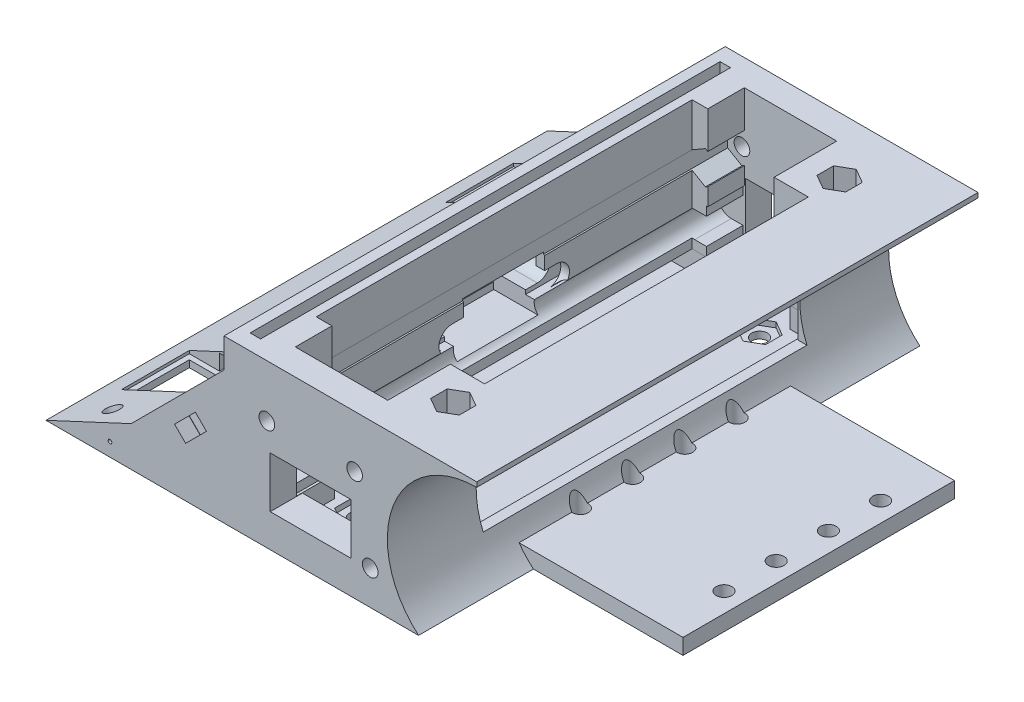
from build123d import *

# Parameters (mm, degrees)
EXTRUDE_1_DEPTH           = 48
EXTRUDE_1_DEPTH_BACK      = 48
SKETCH_2_W                = 35
SKETCH_2_H                = 22
CUT_EXTRUDE_1_DEPTH       = 50
SKETCH_3_W                = 15.5
SKETCH_3_H                = 8.4
CUT_EXTRUDE_2_DEPTH       = 50
SKETCH_4_W                = 15.5
SKETCH_4_H                = 11
CUT_EXTRUDE_3_DEPTH       = 20
SKETCH_7_W                = 15.5
SKETCH_7_H                = 8.4
CUT_EXTRUDE_6_DEPTH       = 116
CUT_EXTRUDE_7_DEPTH       = 43
CUT_EXTRUDE_7_DEPTH_BACK  = 43
SKETCH_10_R               = 1.5
CUT_EXTRUDE_9_DEPTH       = 10
CUT_EXTRUDE_10_DEPTH      = 13
CUT_EXTRUDE_11_REACH      = 74.435
SKETCH_12_W               = 25.251430991
SKETCH_12_H               = 72
EXTRUDE_2_DEPTH           = 10
EXTRUDE_START             = -96
EXTRUDE_3_DEPTH           = 96
CUT_EXTRUDE_12_DEPTH      = 120.230868609
EXTRUDE_4_DEPTH           = 96
CUT_EXTRUDE_13_DEPTH      = 5
CUT_EXTRUDE_14_REACH      = 77.945
SKETCH_19_W               = 8.551430991
SKETCH_19_H               = 62
CUT_EXTRUDE_16_DEPTH      = 4
CUT_EXTRUDE_17_DEPTH      = 2
CUT_EXTRUDE_17_DEPTH_BACK = 1
SKETCH_21_W               = 18.437607381
SKETCH_21_H               = 70.88414514
FILLET_1_R                = 10
FILLET_2_R                = 5
CUT_EXTRUDE_19_DEPTH      = 20
SKETCH_26_W               = 19
SKETCH_26_H               = 13
SKETCH_26_W_2             = 17
SKETCH_26_H_2             = 11
EXTRUDE_7_DEPTH           = 1.321078777
SKETCH_28_R               = 1.5
CUT_EXTRUDE_20_DEPTH      = 20
SKETCH_29_W               = 2
SKETCH_29_H               = 11
SKETCH_29_W_2             = 0.2
EXTRUDE_8_DEPTH           = 5
SKETCH_30_W               = 15.5
SKETCH_30_H               = 4.976277967
EXTRUDE_9_DEPTH           = 5
EXTRUDE_10_DEPTH          = 5
SKETCH_32_R               = 1.5
SKETCH_32_R_2             = 1.499999998
CUT_EXTRUDE_21_DEPTH      = 20
CUT_EXTRUDE_START         = -1.5
CUT_EXTRUDE_22_DEPTH      = 20
SKETCH_34_R               = 1.5
CUT_EXTRUDE_23_DEPTH      = 20
CUT_EXTRUDE_24_DEPTH      = 1
SKETCH_36_R               = 1.5
CUT_EXTRUDE_25_DEPTH      = 15
CUT_EXTRUDE_START_2       = -3
CUT_EXTRUDE_26_DEPTH      = 3
SKETCH_38_W               = 3.029039313
SKETCH_38_H               = 5.639389484
SKETCH_38_W_2             = 2.769556695
CUT_EXTRUDE_28_DEPTH      = 3
CUT_EXTRUDE_29_DEPTH      = 116.243221181
CUT_EXTRUDE_29_DEPTH_BACK = 116.243221181
SKETCH_39_R               = 1.5
CUT_EXTRUDE_START_3       = -7
CUT_EXTRUDE_30_DEPTH      = 79
SKETCH_44_R               = 1.5
CUT_EXTRUDE_33_DEPTH      = 120.230868609
SKETCH_45_R               = 0.35
CUT_EXTRUDE_34_DEPTH      = 120.230868609
EXTRUDE_11_DEPTH          = 96
SKETCH_48_W               = 2
SKETCH_48_H               = 90
CUT_EXTRUDE_35_DEPTH      = 20


with BuildPart() as part:
    # Эскиз1 → Бобышка-Вытянуть1 (new, two sides: drawn at the far end of the back side and taken through both)
    with BuildSketch(Plane.XY.offset(-EXTRUDE_1_DEPTH_BACK)):
        Polygon((-50, -50), (-33.686459833, -42.392871289), (-20.251430991, -28.957842446), (-7.251430991, -28.957842446), (-7.251430991, -39.957842446), (10.448569009, -39.957842446), (10.448569009, -28.957842446), (15, -28.957842446), (15, -47), (50, -47), (50, -50), align=None)
    extrude(amount=EXTRUDE_1_DEPTH + EXTRUDE_1_DEPTH_BACK)

    # Эскиз2 → Вырез-Вытянуть1 (cut)
    with BuildSketch(Plane(origin=(0, -47, 0), x_dir=(1, 0, 0), z_dir=(0, 1, 0))):
        with Locations((32.5, 37)):
            Rectangle(SKETCH_2_W, SKETCH_2_H)
        with Locations((32.5, -37)):
            Rectangle(SKETCH_2_W, SKETCH_2_H)
    extrude(amount=-CUT_EXTRUDE_1_DEPTH, mode=Mode.SUBTRACT)

    # Эскиз3 → Вырез-Вытянуть2 (cut)
    with BuildSketch(Plane(origin=(0, 0, 0), x_dir=(0, 0, -1), z_dir=(1, 0, 0))):
        with Locations((0, -35.675356867)):
            Rectangle(SKETCH_3_W, SKETCH_3_H)
    extrude(amount=-CUT_EXTRUDE_2_DEPTH, mode=Mode.SUBTRACT)

    # Эскиз4 → Вырез-Вытянуть3 (cut)
    with BuildSketch(Plane(origin=(0, 0, 0), x_dir=(0, 0, -1), z_dir=(1, 0, 0))):
        with Locations((0, -35.675356867)):
            Rectangle(SKETCH_4_W, SKETCH_4_H)
    extrude(amount=-CUT_EXTRUDE_3_DEPTH, mode=Mode.SUBTRACT)

    # Эскиз7 → Вырез-Вытянуть6 (cut)
    with BuildSketch(Plane.XY.offset(48)):
        with Locations((0.698569009, -39.478921223)):
            Rectangle(SKETCH_7_W, SKETCH_7_H)
    extrude(amount=-CUT_EXTRUDE_6_DEPTH, mode=Mode.SUBTRACT)

    # Эскиз6 → Вырез-Вытянуть7 (cut, two sides: drawn at the far end of the back side and taken through both)
    with BuildSketch(Plane.XY.offset(-CUT_EXTRUDE_7_DEPTH_BACK)):
        with BuildLine():
            Line((-9.754002232, -36.910622494), (-7.504002232, -36.910622494))
            Line((-7.504002232, -36.910622494), (-7.504002232, -35.210622494))
            Line((-7.504002232, -35.210622494), (7.995997768, -35.210622494))
            Line((7.995997768, -35.210622494), (7.995997768, -36.910622494))
            Line((7.995997768, -36.910622494), (10.245997768, -36.910622494))
            ThreePointArc((10.245997768, -36.910622494), (12.745997768, -39.410622494), (10.245997768, -41.910622494))
            Line((10.245997768, -41.910622494), (7.995997768, -41.910622494))
            Line((7.995997768, -41.910622494), (7.995997768, -43.610622494))
            Line((7.995997768, -43.610622494), (-7.504002232, -43.610622494))
            Line((-7.504002232, -43.610622494), (-7.504002232, -41.910622494))
            Line((-7.504002232, -41.910622494), (-9.754002232, -41.910622494))
            ThreePointArc((-9.754002232, -41.910622494), (-12.254002232, -39.410622494), (-9.754002232, -36.910622494))
        make_face()
    extrude(amount=CUT_EXTRUDE_7_DEPTH + CUT_EXTRUDE_7_DEPTH_BACK, mode=Mode.SUBTRACT)

    # Эскиз10 → Вырез-Вытянуть9 (cut)
    with BuildSketch(Plane(origin=(0, -47, 0), x_dir=(1, 0, 0), z_dir=(0, 1, 0))):
        with Locations(Location((46.25, -14.4, 0), (0, 0, 270))):
            Circle(SKETCH_10_R)
        with Locations(Location((18.75, -14.4, 0), (0, 0, 270))):
            Circle(SKETCH_10_R)
        with Locations(Location((18.75, -4.4, 0), (0, 0, 270))):
            Circle(SKETCH_10_R)
        with Locations(Location((46.25, -4.4, 0), (0, 0, 270))):
            Circle(SKETCH_10_R)
        with Locations(Location((18.75, 5.6, 0), (0, 0, 270))):
            Circle(SKETCH_10_R)
        with Locations(Location((46.25, 5.6, 0), (0, 0, 270))):
            Circle(SKETCH_10_R)
        with Locations(Location((18.75, 15.6, 0), (0, 0, 270))):
            Circle(SKETCH_10_R)
        with Locations(Location((46.25, 15.6, 0), (0, 0, 270))):
            Circle(SKETCH_10_R)
    extrude(amount=-CUT_EXTRUDE_9_DEPTH, mode=Mode.SUBTRACT)

    # Эскиз11 → Вырез-Вытянуть10 (cut)
    with BuildSketch(Plane(origin=(-7.251430991, 0, 0), x_dir=(0, 0, -1), z_dir=(1, 0, 0))):
        with BuildLine():
            Line((-10, -33.175356867), (-7.75, -33.175356867))
            Line((-7.75, -33.175356867), (-7.75, -31.475356867))
            Line((-7.75, -31.475356867), (7.75, -31.475356867))
            Line((7.75, -31.475356867), (7.75, -33.175356867))
            Line((7.75, -33.175356867), (10, -33.175356867))
            ThreePointArc((10, -33.175356867), (12.5, -35.675356867), (10, -38.175356867))
            Line((10, -38.175356867), (7.75, -38.175356867))
            Line((7.75, -38.175356867), (7.75, -39.875356867))
            Line((7.75, -39.875356867), (-7.75, -39.875356867))
            Line((-7.75, -39.875356867), (-7.75, -38.175356867))
            Line((-7.75, -38.175356867), (-10, -38.175356867))
            ThreePointArc((-10, -38.175356867), (-12.5, -35.675356867), (-10, -33.175356867))
        make_face()
    extrude(amount=-CUT_EXTRUDE_10_DEPTH, mode=Mode.SUBTRACT)

    # Вырез-Вытянуть11: up to this face of the body (flat: up to its plane)
    cut_extrude_11_end = Plane(part.part.faces().sort_by_distance((0.698569009, -43.678921223, 0))[0])
    # Эскиз12 → Вырез-Вытянуть11 (cut, up to the picked face)
    with BuildSketch(Plane(origin=(0, -28.957842446, 0), x_dir=(1, 0, 0), z_dir=(0, 1, 0)), mode=Mode.PRIVATE) as cut_extrude_11_sk1:
        with Locations((2.374284505, 0)):
            Rectangle(SKETCH_12_W, SKETCH_12_H)
    cut_extrude_11_tool1 = split(extrude(cut_extrude_11_sk1.sketch, amount=-CUT_EXTRUDE_11_REACH, mode=Mode.PRIVATE), bisect_by=cut_extrude_11_end, keep=Keep.BOTH, mode=Mode.PRIVATE)
    add(cut_extrude_11_tool1.solids().sort_by(Axis((2.374285, -28.957842, 0), (0, -1, 0)))[0], mode=Mode.SUBTRACT)

    # Эскиз13 → Бобышка-Вытянуть2 (add)
    with BuildSketch(Plane(origin=(0, -28.957842446, 0), x_dir=(1, 0, 0), z_dir=(0, 1, 0))):
        Polygon((-7.251430991, 48), (-10.251430991, 48), (-17.458597899, 48), (-17.458597899, -48), (-10.251430991, -48), (-7.251430991, -48), (10.448569009, -48), (15, -48), (15, -36), (15, -26), (10.448569009, -26), (10.448569009, -36), (10.448569009, -43), (-7.251430991, -43), (-7.251430991, -36), (-10.251430991, -36), (-10.251430991, 36), (-7.251430991, 36), (-7.251430991, 43), (10.448569009, 43), (10.448569009, 36), (10.448569009, 26), (15, 26), (15, 36), (15, 48), (10.448569009, 48), align=None)
    extrude(amount=EXTRUDE_2_DEPTH)

    # Эскиз14 → Бобышка-Вытянуть3 (add)
    with BuildSketch(Plane.XY.offset(48).offset(EXTRUDE_START)):
        with BuildLine():
            Line((15, -18.957842446), (32.5, -18.957842446))
            Line((32.5, -18.957842446), (32.5, -19.875869461))
            ThreePointArc((32.5, -19.875869461), (16.439963516, -31.057687752), (21.353886475, -50))
            Line((21.353886475, -50), (15, -50))
            Line((15, -50), (15, -18.957842446))
        make_face()
    extrude(amount=EXTRUDE_3_DEPTH)

    # Эскиз16 → Вырез-Вытянуть12 (cut, through all)
    with BuildSketch(Plane(origin=(0, 0, -48), x_dir=(-1, 0, 0), z_dir=(0, 0, -1))):
        Polygon((20.251430991, -28.957842446), (8.966245749, -17.672657205), (20.251430991, -17.672657205), align=None)
    extrude(amount=-CUT_EXTRUDE_12_DEPTH, mode=Mode.SUBTRACT)

    # Эскиз17 → Бобышка-Вытянуть4 (add)
    with BuildSketch(Plane(origin=(0, 0, -48), x_dir=(-1, 0, 0), z_dir=(0, 0, -1))):
        Polygon((17.458597899, -26.165009354), (17.458597899, -28.957842446), (20.251430991, -28.957842446), align=None)
    extrude(amount=-EXTRUDE_4_DEPTH)

    # Эскиз18 → Вырез-Вытянуть13 (cut)
    with BuildSketch(Plane(origin=(0, -18.957842446, 0), x_dir=(1, 0, 0), z_dir=(0, 1, 0))):
        Polygon((17, -33.824573519), (19.75, -35.41228676), (19.75, -38.58771324), (17, -40.175426481), (14.25, -38.58771324), (14.25, -35.41228676), align=None)
        Polygon((17, 33.824573519), (19.75, 35.41228676), (19.75, 38.58771324), (17, 40.175426481), (14.25, 38.58771324), (14.25, 35.41228676), align=None)
    extrude(amount=-CUT_EXTRUDE_13_DEPTH, mode=Mode.SUBTRACT)

    # Вырез-Вытянуть14: up to this face of the body (flat: up to its plane)
    cut_extrude_14_end = Plane(part.part.faces().sort_by_distance((2.089655811, -43.678921223, 0))[0])
    # Эскиз19 → Вырез-Вытянуть14 (cut, up to the picked face)
    with BuildSketch(Plane(origin=(0, -18.957842446, 0), x_dir=(1, 0, 0), z_dir=(0, 1, 0)), mode=Mode.PRIVATE) as cut_extrude_14_sk1:
        with Locations((12.724284504, 0)):
            Rectangle(SKETCH_19_W, SKETCH_19_H)
    cut_extrude_14_tool1 = split(extrude(cut_extrude_14_sk1.sketch, amount=-CUT_EXTRUDE_14_REACH, mode=Mode.PRIVATE), bisect_by=cut_extrude_14_end, keep=Keep.BOTH, mode=Mode.PRIVATE)
    add(cut_extrude_14_tool1.solids().sort_by(Axis((12.724285, -18.957842, 0), (0, -1, 0)))[0], mode=Mode.SUBTRACT)

    # Эскиз20 → Вырез-Вытянуть16 (cut)
    with BuildSketch(Plane(origin=(0, -43.678921223, 0), x_dir=(1, 0, 0), z_dir=(0, 1, 0))):
        Polygon((-10.190051422, -35.660220789), (-31.693313891, -35.660220789), (-31.693313891, 36.035597423), (-10.190051422, 36.035597423), (-7.051430991, 36.035597423), (-7.051430991, 42.017798712), (8.448569009, 42.017798712), (8.448569009, 36.035597423), (14.782810685, 36.035597423), (14.782810685, -35.660220789), (8.448569009, -35.660220789), (8.448569009, -41.830110395), (-7.051430991, -41.830110395), (-7.051430991, -35.660220789), align=None)
    extrude(amount=-CUT_EXTRUDE_16_DEPTH, mode=Mode.SUBTRACT)

    # Эскиз21 → Вырез-Вытянуть17 (cut, two sides: drawn at the far end of the back side and taken through both)
    with BuildSketch(Plane(origin=(0, -47.678921223, 0), x_dir=(1, 0, 0), z_dir=(0, 1, 0)).offset(-CUT_EXTRUDE_17_DEPTH_BACK)):
        with Locations((-31.014894997, -0.15677815)):
            Rectangle(SKETCH_21_W, SKETCH_21_H)
    extrude(amount=CUT_EXTRUDE_17_DEPTH + CUT_EXTRUDE_17_DEPTH_BACK, mode=Mode.SUBTRACT)

    # Скругление1
    # the kernel refuses this fillet: 10 mm, written as the material it takes off along each edge
    with BuildSketch(Plane(origin=(-21.796091306, -47.678921223, -35.28529442), x_dir=(1, 0, 0), z_dir=(0, 0, 1))) as fillet_1_piece_1:
        with BuildLine():
            CenterArc((4.358898944, -10), FILLET_1_R, 90, 25.841932763)
            Line((0, -1), (-0.087177979, -0.82))
            ThreePointArc((-0.087177979, -0.82), (-0.2, -0.5), (-0.2, 0))
            Line((-0.2, 0), (0, 0.2))
            Line((0, 0.2), (4.358898944, 0.2))
            Line((4.358898944, 0.2), (4.358898944, 0))
        make_face()
    extrude(amount=70.884145139, mode=Mode.SUBTRACT)

    # Скругление2
    # the kernel refuses this fillet: 5 mm, written as the material it takes off along each edge
    with BuildSketch(Plane(origin=(-31.693313891, -45.678921223, 35.59885072), x_dir=(0, 1, 0), z_dir=(0, 0, -1))) as fillet_2_piece_1:
        with BuildLine():
            CenterArc((5, -4), FILLET_2_R, 126.869897646, 53.130102354)
            Line((0, -4), (-0.1, -4))
            Line((-0.1, -4), (-0.1, 0))
            Line((-0.1, 0), (0, 0.1))
            ThreePointArc((0, 0.1), (1, 0.1), (1.94, 0.08))
            Line((1.94, 0.08), (2, 0))
        make_face()
    extrude(amount=70.884145139, mode=Mode.SUBTRACT)

    # Эскиз25 → Вырез-Вытянуть19 (cut)
    with BuildSketch(Plane(origin=(0, -39.875356867, 0), x_dir=(1, 0, 0), z_dir=(0, 1, 0))):
        Polygon((-33.686459833, 37.554781262), (-46, 37.554781262), (-46, 24.554781262), (-34, 24.554781262), (-27, 24.554781262), (-27, 37.554781262), align=None)
        Polygon((-33.686459833, -37.554781262), (-27, -37.554781262), (-27, -24.554781262), (-34, -24.554781262), (-46, -24.554781262), (-46, -37.554781262), align=None)
    extrude(amount=-CUT_EXTRUDE_19_DEPTH, mode=Mode.SUBTRACT)

    # Эскиз26 → Бобышка-Вытянуть7 (add)
    # profile 1 of 2: a face of its own
    with BuildSketch(Plane.XZ.offset(50)):
        with Locations((-36.5, -31.054781262)):
            Rectangle(SKETCH_26_W, SKETCH_26_H)
        with Locations((-36.5, -31.054781262)):
            Rectangle(SKETCH_26_W_2, SKETCH_26_H_2, mode=Mode.SUBTRACT)
    # profile 2 of 2: a face of its own
    with BuildSketch(Plane.XZ.offset(50)):
        with Locations((-36.5, 31.054781262)):
            Rectangle(SKETCH_26_W, SKETCH_26_H)
        with Locations((-36.5, 31.054781262)):
            Rectangle(SKETCH_26_W_2, SKETCH_26_H_2, mode=Mode.SUBTRACT)
    extrude(amount=-EXTRUDE_7_DEPTH)

    # Эскиз28 → Вырез-Вытянуть20 (cut)
    with BuildSketch(Plane(origin=(0, -42.5, 0), x_dir=(1, 0, 0), z_dir=(0, 1, 0))):
        with Locations(Location((18.75, -14.4, 0), (0, 0, 264.225137308))):
            Circle(SKETCH_28_R)
        with Locations(Location((18.75, -4.4, 0), (0, 0, 264.225137308))):
            Circle(SKETCH_28_R)
        with Locations(Location((18.75, 5.6, 0), (0, 0, 264.225137308))):
            Circle(SKETCH_28_R)
        with Locations(Location((18.75, 15.6, 0), (0, 0, 264.225137308))):
            Circle(SKETCH_28_R)
    extrude(amount=-CUT_EXTRUDE_20_DEPTH, mode=Mode.SUBTRACT)

    # Эскиз29 → Бобышка-Вытянуть8 (add)
    with BuildSketch(Plane.XY.offset(48)):
        with Locations((9.448569009, -34.457842446)):
            Rectangle(SKETCH_29_W, SKETCH_29_H)
        with Locations((-7.151430991, -34.457842446)):
            Rectangle(SKETCH_29_W_2, SKETCH_29_H)
    extrude(amount=-EXTRUDE_8_DEPTH)

    # Эскиз30 → Бобышка-Вытянуть9 (add)
    with BuildSketch(Plane.XY.offset(48)):
        with Locations((0.698569009, -31.44598143)):
            Rectangle(SKETCH_30_W, SKETCH_30_H)
    extrude(amount=-EXTRUDE_9_DEPTH)

    # Эскиз31 → Бобышка-Вытянуть10 (add)
    with BuildSketch(Plane(origin=(0, 0, -48), x_dir=(-1, 0, 0), z_dir=(0, 0, -1))):
        Polygon((7.051430991, -39.957842446), (7.251430991, -39.957842446), (7.251430991, -28.957842446), (7.051430991, -28.957842446), (-8.448569009, -28.957842446), (-10.448569009, -28.957842446), (-10.448569009, -39.957842446), (-8.448569009, -39.957842446), (-8.448569009, -33.882619689), (7.051430991, -33.882619689), align=None)
    extrude(amount=-EXTRUDE_10_DEPTH)

    # Эскиз32 → Вырез-Вытянуть21 (cut)
    with BuildSketch(Plane(origin=(10.22080132, -21.918579164, 0), x_dir=(0.9063077870366492, 0.422618261740701, 0), z_dir=(-0.42261826174070105, 0.9063077870366493, 0))):
        with Locations(Location((-57.12262942, 43.70967988, 0), (0, 0, 180))):
            Circle(SKETCH_32_R)
        with Locations(Location((-57.12262942, -43.70967988, 0), (0, 0, 180))):
            Circle(SKETCH_32_R_2)
    extrude(amount=-CUT_EXTRUDE_21_DEPTH, mode=Mode.SUBTRACT)

    # Эскиз33 → Вырез-Вытянуть22 (cut)
    with BuildSketch(Plane(origin=(10.22080132, -21.918579164, 0), x_dir=(0.9063077870366492, 0.422618261740701, 0), z_dir=(-0.42261826174070105, 0.9063077870366493, 0)).offset(CUT_EXTRUDE_START)):
        Polygon((-57.075584177, 40.534601916), (-54.349408622, 42.162883274), (-54.396453865, 45.337961238), (-57.169674662, 46.884757845), (-59.895850217, 45.256476487), (-59.848804974, 42.081398523), align=None)
        Polygon((-59.895850217, -45.256476487), (-59.848804974, -42.081398523), (-57.075584177, -40.534601916), (-54.349408622, -42.162883274), (-54.396453865, -45.337961238), (-57.169674662, -46.884757845), align=None)
    extrude(amount=-CUT_EXTRUDE_22_DEPTH, mode=Mode.SUBTRACT)

    # Эскиз34 → Вырез-Вытянуть23 (cut)
    with BuildSketch(Plane(origin=(0, -47.678921223, 0), x_dir=(1, 0, 0), z_dir=(0, 1, 0))):
        with Locations(Location((-2.726430991, -35.660220789, 0), (0, 0, 270))):
            Circle(SKETCH_34_R)
        with Locations(Location((5.923569009, -35.660220789, 0), (0, 0, 90))):
            Circle(SKETCH_34_R)
        with Locations(Location((-2.726430991, 32.746976788, 0), (0, 0, 90))):
            Circle(SKETCH_34_R)
        with Locations(Location((5.923569009, 32.746976788, 0), (0, 0, 270))):
            Circle(SKETCH_34_R)
    extrude(amount=-CUT_EXTRUDE_23_DEPTH, mode=Mode.SUBTRACT)

    # Эскиз35 → Вырез-Вытянуть24 (cut)
    with BuildSketch(Plane(origin=(0, -47.678921223, 0), x_dir=(1, 0, 0), z_dir=(0, 1, 0))):
        Polygon((-2.726430991, -32.484794309), (-5.476430991, -34.072507549), (-5.476430991, -37.24793403), (-2.726430991, -38.83564727), (0.023569009, -37.24793403), (0.023569009, -34.072507549), align=None)
        Polygon((3.173569009, -34.072507549), (5.923569009, -32.484794309), (8.673569009, -34.072507549), (8.673569009, -37.24793403), (5.923569009, -38.83564727), (3.173569009, -37.24793403), align=None)
        Polygon((-2.726430991, 29.571550307), (0.023569009, 31.159263548), (0.023569009, 34.334690028), (-2.726430991, 35.922403268), (-5.476430991, 34.334690028), (-5.476430991, 31.159263548), align=None)
        Polygon((5.923569009, 29.571550307), (8.673569009, 31.159263548), (8.673569009, 34.334690028), (5.923569009, 35.922403268), (3.173569009, 34.334690028), (3.173569009, 31.159263548), align=None)
    extrude(amount=-CUT_EXTRUDE_24_DEPTH, mode=Mode.SUBTRACT)

    # Эскиз36 → Вырез-Вытянуть25 (cut)
    with BuildSketch(Plane(origin=(4.353205728, -4.353205728, 0), x_dir=(0, 0, 1), z_dir=(-0.7071067811865485, 0.7071067811865466, 0))):
        with Locations(Location((-43.70967988, -42.233216236, 0), (0, 0, 270))):
            Circle(SKETCH_36_R)
        with Locations(Location((43.70967988, -42.233216236, 0), (0, 0, 270))):
            Circle(SKETCH_36_R)
    extrude(amount=-CUT_EXTRUDE_25_DEPTH, mode=Mode.SUBTRACT)

    # Эскиз37 → Вырез-Вытянуть26 (cut)
    with BuildSketch(Plane(origin=(4.353205728, -4.353205728, 0), x_dir=(0, 0, 1), z_dir=(-0.7071067811865485, 0.7071067811865466, 0)).offset(CUT_EXTRUDE_START_2)):
        Polygon((-40.5342534, -42.233216236), (-42.12196664, -39.483216236), (-45.297393121, -39.483216236), (-46.885106361, -42.233216236), (-45.297393121, -44.983216236), (-42.12196664, -44.983216236), align=None)
        Polygon((46.885106361, -42.233216236), (45.297393121, -39.483216236), (42.12196664, -39.483216236), (40.5342534, -42.233216236), (42.12196664, -44.983216236), (45.297393121, -44.983216236), align=None)
    extrude(amount=-CUT_EXTRUDE_26_DEPTH, mode=Mode.SUBTRACT)

    # Эскиз38 → Вырез-Вытянуть28 (cut)
    with BuildSketch(Plane(origin=(8.595846415, -8.595846415, 0), x_dir=(0, 0, 1), z_dir=(-0.7071067811865481, 0.707106781186547, 1.6024689053196346e-15))):
        with Locations((-46.485480344, -42.229924751)):
            Rectangle(SKETCH_38_W, SKETCH_38_H)
        with Locations((46.615221652, -42.229924751)):
            Rectangle(SKETCH_38_W_2, SKETCH_38_H)
    extrude(amount=CUT_EXTRUDE_28_DEPTH, mode=Mode.SUBTRACT)

    # Эскиз39 → Вырез-Вытянуть29 (cut, two sides: drawn at the far end of the back side and taken through both)
    with BuildSketch(Plane.XY.offset(-43).offset(-CUT_EXTRUDE_29_DEPTH_BACK)):
        with Locations((-7.707740843, -28.957842446)):
            Circle(SKETCH_39_R)
        with Locations((9.104878861, -28.957842446)):
            Circle(SKETCH_39_R)
    extrude(amount=CUT_EXTRUDE_29_DEPTH + CUT_EXTRUDE_29_DEPTH_BACK, mode=Mode.SUBTRACT)

    # Эскиз42 → Вырез-Вытянуть30 (cut)
    with BuildSketch(Plane.XY.offset(-36).offset(CUT_EXTRUDE_START_3)):
        Polygon((-7.707740843, -25.782415966), (-10.457740843, -27.370129206), (-10.457740843, -30.545555686), (-7.707740843, -32.133268927), (-4.957740843, -30.545555686), (-4.957740843, -27.370129206), align=None)
        Polygon((9.104878861, -32.133268927), (11.854878861, -30.545555686), (11.854878861, -27.370129206), (9.104878861, -25.782415966), (6.354878861, -27.370129206), (6.354878861, -30.545555686), align=None)
    extrude(amount=CUT_EXTRUDE_30_DEPTH, mode=Mode.SUBTRACT)

    # Эскиз44 → Вырез-Вытянуть33 (cut, through all)
    with BuildSketch(Plane.XY.offset(48)):
        with Locations((12.09252036, -43.467612092)):
            Circle(SKETCH_44_R)
    extrude(amount=-CUT_EXTRUDE_33_DEPTH, mode=Mode.SUBTRACT)

    # Эскиз45 → Вырез-Вытянуть34 (cut, through all)
    with BuildSketch(Plane.XY.offset(48)):
        with Locations((-37.751845026, -47.39273475)):
            Circle(SKETCH_45_R)
    extrude(amount=-CUT_EXTRUDE_34_DEPTH, mode=Mode.SUBTRACT)

    # Эскиз47 → Бобышка-Вытянуть11 (add)
    with BuildSketch(Plane(origin=(0, 0, -48), x_dir=(-1, 0, 0), z_dir=(0, 0, -1))):
        Polygon((10.251430991, -18.957842446), (15.905083818, -24.611495273), (15.905083818, -18.957842446), align=None)
    extrude(amount=-EXTRUDE_11_DEPTH)

    # Эскиз48 → Вырез-Вытянуть35 (cut)
    with BuildSketch(Plane(origin=(0, -18.957842446, 0), x_dir=(1, 0, 0), z_dir=(0, 1, 0))):
        with Locations((-12.905083818, 0)):
            Rectangle(SKETCH_48_W, SKETCH_48_H)
    extrude(amount=-CUT_EXTRUDE_35_DEPTH, mode=Mode.SUBTRACT)


solid = part.part
